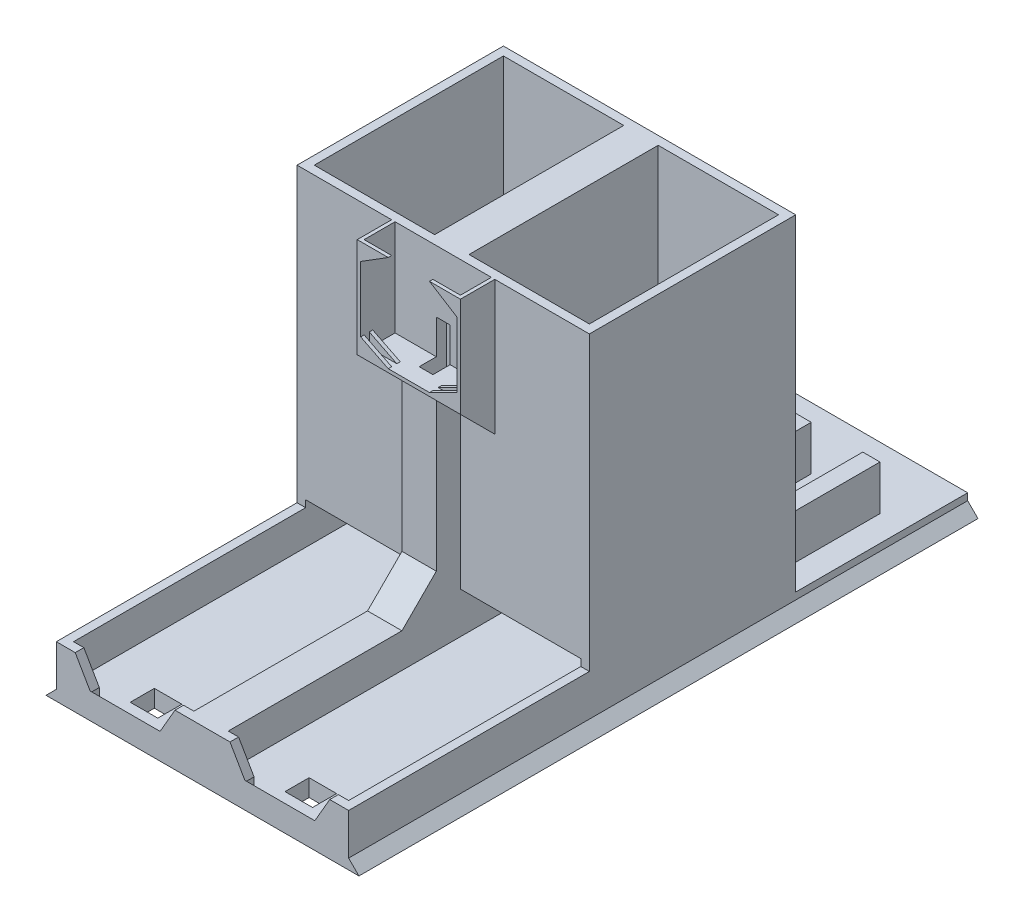
from build123d import *

# Parameters (mm, degrees)
SKETCH1_W                                 = 85
SKETCH1_H                                 = 60
BOSS_EXTRUDE1_DEPTH                       = 100
CUT_EXTRUDE1_START                        = 5
SKETCH2_W                                 = 35
SKETCH2_H                                 = 55
CUT_EXTRUDE1_DEPTH                        = 95
SKETCH3_W                                 = 85
SKETCH3_H                                 = 5
BOSS_EXTRUDE2_DEPTH                       = 70
BOSS_EXTRUDE3_DEPTH                       = 10
SKETCH5_W                                 = 20
SKETCH5_H                                 = 2.5
CUT_EXTRUDE2_DEPTH                        = 7.5
SKETCH6_W                                 = 35
SKETCH6_H                                 = 12
CUT_EXTRUDE4_DEPTH                        = 57.5
CUT_EXTRUDE6_REACH                        = 186.73
SKETCH7_R                                 = 4
SKETCH9_W                                 = 85
SKETCH9_H                                 = 50
BOSS_EXTRUDE4_DEPTH                       = 5
SKETCH13_W                                = 8
SKETCH13_H                                = 7
CUT_EXTRUDE8_BUTTON_HOLES_DEPTH           = 169.374582405
BOSS_EXTRUDE5_OLED_MOUNT_DEPTH            = 10
BOSS_EXTRUDE6_OLED_MOUNT_DEPTH            = 1
BOSS_EXTRUDE7_START                       = -2.5
BOSS_EXTRUDE7_OLED_MOUNT_DEPTH            = 1
BOSS_EXTRUDE8_OLED_MOUNT_DEPTH            = 1
BOSS_EXTRUDE13_OLED_MOUNT_SUPPORT_DEPTH   = 30
CUT_EXTRUDE9_OLED_CABLE_DEPTH             = 10
CUT_EXTRUDE9_OLED_CABLE_DEPTH_BACK        = 157.553505231
SKETCH18_W                                = 4
SKETCH18_H                                = 8
BOSS_EXTRUDE12_OLED_CABLE_GUIDE_REACH     = 164.942
SKETCH20_W                                = 10
SKETCH20_H                                = 10
CUT_EXTRUDE10_SOLENOID_WIRE_HOLE_DEPTH    = 169.374582405
SKETCH21_W                                = 5
SKETCH21_H                                = 32
BOSS_EXTRUDE9_SOLENOID_SIDE_SUPPORT_DEPTH = 13
CHAMFER3_THUMB_SIZE                       = 2.5
CHAMFER5_THUMB_SIZE                       = 4.5
CHAMFER5_THUMB_SIZE2                      = 7.794228634
CHAMFER5_THUMB_PART_2_SIZE                = 4.5
CHAMFER5_THUMB_PART_2_SIZE2               = 7.794228634
CHAMFER5_THUMB_PART_3_SIZE                = 4.5
CHAMFER5_THUMB_PART_3_SIZE2               = 7.794228634
BOSS_EXTRUDE5_GUIDE_DEPTH                 = 180
SKETCH49_W                                = 10
SKETCH49_H                                = 10
BOSS_EXTRUDE14_DEPTH                      = 10
CHAMFER8_SIZE                             = 10


with BuildPart() as part:
    # Sketch1 → Boss-Extrude1 (new body)
    with BuildSketch(Plane(origin=(0, 0, 0), x_dir=(1, 0, 0), z_dir=(0, 1, 0))):
        with Locations((42.5, 30)):
            Rectangle(SKETCH1_W, SKETCH1_H)
    extrude(amount=BOSS_EXTRUDE1_DEPTH)

    # Sketch2 → Cut-Extrude1 (cut)
    with BuildSketch(Plane(origin=(0, 0, 0), x_dir=(1, 0, 0), z_dir=(0, 1, 0)).offset(CUT_EXTRUDE1_START)):
        with Locations((20, 30)):
            Rectangle(SKETCH2_W, SKETCH2_H)
        with Locations((65, 30)):
            Rectangle(SKETCH2_W, SKETCH2_H)
    extrude(amount=CUT_EXTRUDE1_DEPTH, mode=Mode.SUBTRACT)

    # Sketch3 → Boss-Extrude2 (add)
    with BuildSketch(Plane.XY):
        with Locations((42.5, 2.5)):
            Rectangle(SKETCH3_W, SKETCH3_H)
    extrude(amount=BOSS_EXTRUDE2_DEPTH)

    # Sketch4 → Boss-Extrude3 (add)
    with BuildSketch(Plane(origin=(0, 5, 0), x_dir=(1, 0, 0), z_dir=(0, 1, 0))):
        Polygon((85, 0), (82.5, 0), (82.5, -67.5), (47.5, -67.5), (47.5, 0), (37.5, 0), (37.5, -67.5), (2.5, -67.5), (2.5, 0), (0, 0), (0, -70), (85, -70), align=None)
    extrude(amount=BOSS_EXTRUDE3_DEPTH)

    # Sketch5 → Cut-Extrude2 (cut)
    with BuildSketch(Plane(origin=(0, 15, 0), x_dir=(1, 0, 0), z_dir=(0, 1, 0))):
        with Locations((20, -68.75)):
            Rectangle(SKETCH5_W, SKETCH5_H)
        with Locations((65, -68.75)):
            Rectangle(SKETCH5_W, SKETCH5_H)
    extrude(amount=-CUT_EXTRUDE2_DEPTH, mode=Mode.SUBTRACT)

    # Sketch6 → Cut-Extrude4 (cut)
    with BuildSketch(Plane.XY):
        with Locations((20, 11)):
            Rectangle(SKETCH6_W, SKETCH6_H)
        with Locations((65, 11)):
            Rectangle(SKETCH6_W, SKETCH6_H)
    extrude(amount=-CUT_EXTRUDE4_DEPTH, mode=Mode.SUBTRACT)

    # Sketch7 → Cut-Extrude6 (cut, up to next)
    with BuildSketch(Plane(origin=(0, 0, -60), x_dir=(-1, 0, 0), z_dir=(0, 0, -1)), mode=Mode.PRIVATE) as cut_extrude6_sk1:
        with Locations((-20, 11.5)):
            Circle(SKETCH7_R)
    cut_extrude6_tool1 = extrude(cut_extrude6_sk1.sketch, amount=-CUT_EXTRUDE6_REACH, mode=Mode.PRIVATE) & part.part
    # Sketch7 → Cut-Extrude6 (cut, up to next)
    with BuildSketch(Plane(origin=(0, 0, -60), x_dir=(-1, 0, 0), z_dir=(0, 0, -1)), mode=Mode.PRIVATE) as cut_extrude6_sk2:
        with Locations((-65, 11.5)):
            Circle(SKETCH7_R)
    cut_extrude6_tool2 = extrude(cut_extrude6_sk2.sketch, amount=-CUT_EXTRUDE6_REACH, mode=Mode.PRIVATE) & part.part
    add(cut_extrude6_tool1.solids().sort_by_distance((20, 11.5, -60))[0], mode=Mode.SUBTRACT)
    add(cut_extrude6_tool2.solids().sort_by_distance((65, 11.5, -60))[0], mode=Mode.SUBTRACT)

    # Sketch9 → Boss-Extrude4 (add)
    with BuildSketch(Plane(origin=(0, 0, 0), x_dir=(1, 0, 0), z_dir=(0, 1, 0))):
        with Locations((42.5, 85)):
            Rectangle(SKETCH9_W, SKETCH9_H)
    extrude(amount=BOSS_EXTRUDE4_DEPTH)

    # Sketch13 → Cut-Extrude8 (Button Holes) (cut, through all)
    with BuildSketch(Plane(origin=(0, 5, 0), x_dir=(1, 0, 0), z_dir=(0, 1, 0))):
        with Locations((20, -61)):
            Rectangle(SKETCH13_W, SKETCH13_H)
        with Locations((65, -61)):
            Rectangle(SKETCH13_W, SKETCH13_H)
    extrude(amount=-CUT_EXTRUDE8_BUTTON_HOLES_DEPTH, mode=Mode.SUBTRACT)

    # Sketch14 → Boss-Extrude5 (OLED Mount) (add)
    with BuildSketch(Plane.XY):
        Polygon((27.5, 100), (28.5, 100), (28.5, 72), (56.5, 72), (56.5, 100), (57.5, 100), (57.5, 71), (52.172712592, 71), (32.827287408, 71), (27.5, 71), align=None)
    extrude(amount=BOSS_EXTRUDE5_OLED_MOUNT_DEPTH)

    # Sketch15 → Boss-Extrude6 (OLED Mount) (add)
    with BuildSketch(Plane.XY.offset(10)):
        Polygon((28.5, 72), (36.5, 72), (28.5, 76), align=None)
        Polygon((56.5, 76), (56.5, 72), (48.5, 72), align=None)
    extrude(amount=-BOSS_EXTRUDE6_OLED_MOUNT_DEPTH)

    # Sketch15<2> → Boss-Extrude7 (OLED Mount) (add)
    with BuildSketch(Plane.XY.offset(10).offset(BOSS_EXTRUDE7_START)):
        Polygon((28.5, 72), (36.5, 72), (28.5, 76), align=None)
        Polygon((56.5, 76), (56.5, 72), (48.5, 72), align=None)
    extrude(amount=-BOSS_EXTRUDE7_OLED_MOUNT_DEPTH)

    # Sketch17 → Boss-Extrude8 (OLED Mount) (add)
    with BuildSketch(Plane.XY.offset(10)):
        Polygon((56.5, 95), (56.5, 100), (48.5, 100), align=None)
        Polygon((28.5, 100), (36.5, 100), (28.5, 95), align=None)
    extrude(amount=-BOSS_EXTRUDE8_OLED_MOUNT_DEPTH)

    # Sketch32 → Boss-Extrude13 OLED Mount Support) (add)
    with BuildSketch(Plane.ZY.offset(-27.5)):
        Polygon((0, 71), (10, 71), (0, 61), align=None)
    extrude(amount=-BOSS_EXTRUDE13_OLED_MOUNT_SUPPORT_DEPTH)

    # Sketch18 → Cut-Extrude9 (OLED Cable) (cut, two sides: drawn at the far end of the back side and taken through both)
    with BuildSketch(Plane(origin=(0, 72, 0), x_dir=(1, 0, 0), z_dir=(0, 1, 0)).offset(-CUT_EXTRUDE9_OLED_CABLE_DEPTH_BACK)):
        with Locations((42.5, -1)):
            Rectangle(SKETCH18_W, SKETCH18_H)
    extrude(amount=CUT_EXTRUDE9_OLED_CABLE_DEPTH + CUT_EXTRUDE9_OLED_CABLE_DEPTH_BACK, mode=Mode.SUBTRACT)

    # Boss-Extrude12 (OLED Cable Guide): up to this plane
    boss_extrude12_oled_cable_guide_end = Plane(origin=(57.5, 71, 10), z_dir=(0, -0.7071067811865475, 0.7071067811865476))
    # Sketch31 → Boss-Extrude12 (OLED Cable Guide) (add, up to the surface)
    with BuildSketch(Plane(origin=(0, 15, 0), x_dir=(1, 0, 0), z_dir=(0, 1, 0)), mode=Mode.PRIVATE) as boss_extrude12_oled_cable_guide_sk1:
        Polygon((37.5, 0), (40.5, 0), (40.5, -5), (44.5, -5), (44.5, 0), (47.5, 0), (47.5, -7), (37.5, -7), align=None)
    boss_extrude12_oled_cable_guide_tool1 = split(extrude(boss_extrude12_oled_cable_guide_sk1.sketch, amount=BOSS_EXTRUDE12_OLED_CABLE_GUIDE_REACH, mode=Mode.PRIVATE), bisect_by=boss_extrude12_oled_cable_guide_end, keep=Keep.BOTH, mode=Mode.PRIVATE)
    add(boss_extrude12_oled_cable_guide_tool1.solids().sort_by_distance((39, 15, 0.122066))[0])

    # Sketch20 → Cut-Extrude10 (Solenoid Wire Hole) (cut, through all)
    with BuildSketch(Plane(origin=(0, 5, 0), x_dir=(1, 0, 0), z_dir=(0, 1, 0))):
        with Locations((65, 65)):
            Rectangle(SKETCH20_W, SKETCH20_H)
        with Locations((20, 65)):
            Rectangle(SKETCH20_W, SKETCH20_H)
    extrude(amount=-CUT_EXTRUDE10_SOLENOID_WIRE_HOLE_DEPTH, mode=Mode.SUBTRACT)

    # Sketch21 → Boss-Extrude9 (Solenoid Side Support) (add)
    with BuildSketch(Plane(origin=(0, 5, 0), x_dir=(1, 0, 0), z_dir=(0, 1, 0))):
        with Locations((75, 76)):
            Rectangle(SKETCH21_W, SKETCH21_H)
        with Locations((55, 76)):
            Rectangle(SKETCH21_W, SKETCH21_H)
        with Locations((30, 76)):
            Rectangle(SKETCH21_W, SKETCH21_H)
        with Locations((10, 76)):
            Rectangle(SKETCH21_W, SKETCH21_H)
    extrude(amount=BOSS_EXTRUDE9_SOLENOID_SIDE_SUPPORT_DEPTH)

    # Chamfer3 (Thumb)
    chamfer3_thumb_edges = [part.edges().sort_by_distance(p)[0] for p in [
        (20, 7.5, 67.5),
        (65, 7.5, 67.5),
    ]]
    chamfer(chamfer3_thumb_edges, length=CHAMFER3_THUMB_SIZE - 0.0001)  # a hair under: the kernel refuses the full size

    # Chamfer5 (Thumb)
    chamfer5_thumb_edges = [part.edges().sort_by_distance(p)[0] for p in [
        (75, 15, 68.75),
    ]]
    chamfer5_thumb_side = [part.faces().sort_by_distance(p)[0] for p in [
        (83.266129032, 15, 38.266129032),
    ]]
    chamfer(chamfer5_thumb_edges, length=CHAMFER5_THUMB_SIZE, length2=CHAMFER5_THUMB_SIZE2, reference=chamfer5_thumb_side[0])

    # Chamfer5 (Thumb) part 2
    chamfer5_thumb_part_2_edges = [part.edges().sort_by_distance(p)[0] for p in [
        (55, 15, 68.75),
        (30, 15, 68.75),
    ]]
    chamfer5_thumb_part_2_side = [part.faces().sort_by_distance(p)[0] for p in [
        (42.5, 15, 40.199438202),
    ]]
    chamfer(chamfer5_thumb_part_2_edges, length=CHAMFER5_THUMB_PART_2_SIZE, length2=CHAMFER5_THUMB_PART_2_SIZE2, reference=chamfer5_thumb_part_2_side[0])

    # Chamfer5 (Thumb) part 3
    chamfer5_thumb_part_3_edges = [part.edges().sort_by_distance(p)[0] for p in [
        (10, 15, 68.75),
    ]]
    chamfer5_thumb_part_3_side = [part.faces().sort_by_distance(p)[0] for p in [
        (1.733870968, 15, 38.266129032),
    ]]
    chamfer(chamfer5_thumb_part_3_edges, length=CHAMFER5_THUMB_PART_3_SIZE, length2=CHAMFER5_THUMB_PART_3_SIZE2, reference=chamfer5_thumb_part_3_side[0])

    # Sketch37 → Boss-Extrude5 (Guide) (add, through all)
    with BuildSketch(Plane.XY.offset(70)):
        Polygon((85, 0), (88, 0), (85, 3), align=None)
        Polygon((0, 0), (-3, 0), (0, 3), align=None)
    extrude(amount=-BOSS_EXTRUDE5_GUIDE_DEPTH)

    # Sketch49 → Boss-Extrude14 (add)
    with BuildSketch(Plane(origin=(0, 15, 0), x_dir=(1, 0, 0), z_dir=(0, 1, 0))):
        with Locations((42.5, -12)):
            Rectangle(SKETCH49_W, SKETCH49_H)
    extrude(amount=BOSS_EXTRUDE14_DEPTH)

    # Chamfer8
    chamfer8_edges = [part.edges().sort_by_distance(p)[0] for p in [
        (42.5, 25, 17),
    ]]
    chamfer(chamfer8_edges, length=CHAMFER8_SIZE - 0.0001)  # a hair under: the kernel refuses the full size


solid = part.part
